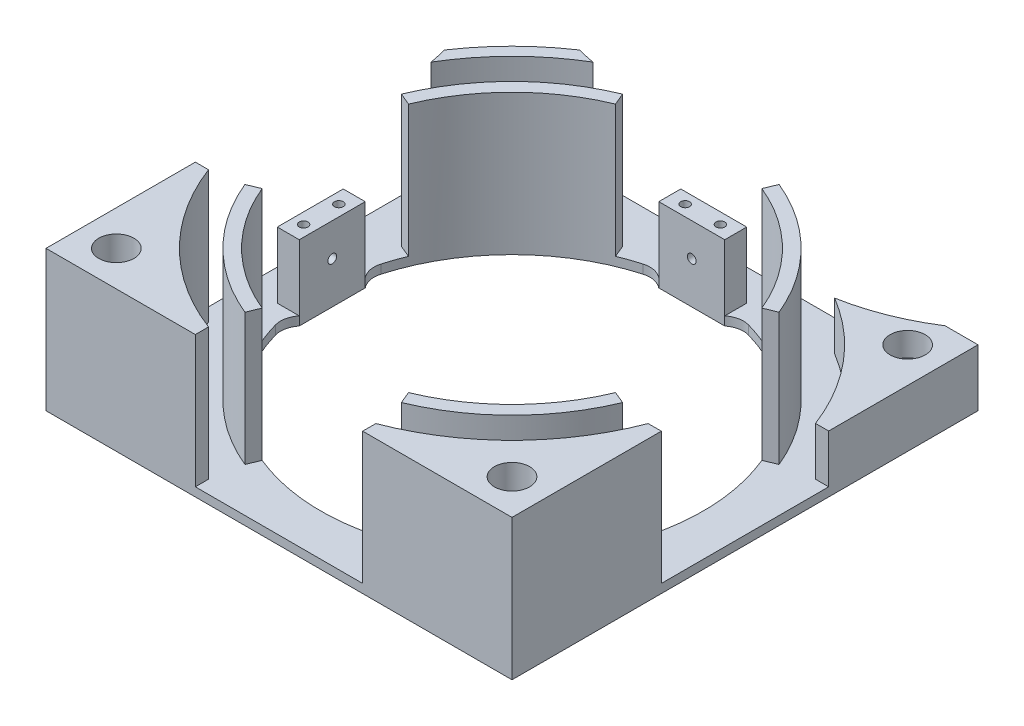
from build123d import *
from build123d.topology import SkipClean

# Parameters (mm, degrees)
SKETCH1_W                                           = 106
SKETCH1_H                                           = 106
BOSS_EXTRUDE1_DEPTH                                 = 2
SKETCH2_R                                           = 46.5
SKETCH2_R_2                                         = 43.5
BOSS_EXTRUDE2_DEPTH                                 = 30
CUT_EXTRUDE1_REACH                                  = 82.734
SKETCH3_R                                           = 43.5
CUT_EXTRUDE2_START                                  = -30
CUT_EXTRUDE2_DEPTH                                  = 30
SKETCH5_W                                           = 15
SKETCH5_H                                           = 5
BOSS_EXTRUDE3_DEPTH                                 = 15
BOSS_EXTRUDE3_DIRECTION_2_REACH                     = 82.734
FILLET1_R                                           = 5
CIRPATTERN1_COUNT                                   = 2
CIRPATTERN1_ANGLE                                   = 90
FILLET1_OF_CIRPATTERN1_R                            = 5
BOSS_EXTRUDE4_DEPTH                                 = 30
BOSS_EXTRUDE5_DEPTH                                 = 15
BOSS_EXTRUDE6_DEPTH                                 = 15
CBORE_FOR_M4_HEX_SOCKET_HEAD_CAP_SCREW1_D           = 4.5
CBORE_FOR_M4_HEX_SOCKET_HEAD_CAP_SCREW1_CBORE_D     = 8
CBORE_FOR_M4_HEX_SOCKET_HEAD_CAP_SCREW1_CBORE_DEPTH = 24.4
CUT_EXTRUDE4_DEPTH                                  = 19
CUT_EXTRUDE5_REACH                                  = 118.672
SKETCH15_R                                          = 1
CUT_EXTRUDE6_REACH                                  = 118.672
SKETCH16_R                                          = 1
SKETCH17_R                                          = 1
CUT_EXTRUDE7_DEPTH                                  = 10


with BuildPart() as part:
    # Sketch1 → Boss-Extrude1 (new body)
    with BuildSketch(Plane(origin=(0, 0, 0), x_dir=(1, 0, 0), z_dir=(0, 1, 0))):
        Rectangle(SKETCH1_W, SKETCH1_H)
    extrude(amount=BOSS_EXTRUDE1_DEPTH)

    # Sketch2 → Boss-Extrude2 (add)
    with BuildSketch(Plane(origin=(0, 2, 0), x_dir=(1, 0, 0), z_dir=(0, 1, 0))):
        with Locations(Location((0, 0, 0), (0, 0, 90))):
            Circle(SKETCH2_R)
        with Locations(Location((0, 0, 0), (0, 0, 270))):
            Circle(SKETCH2_R_2, mode=Mode.SUBTRACT)
    extrude(amount=BOSS_EXTRUDE2_DEPTH)

    # Sketch3 → Cut-Extrude1 (cut, up to next)
    with BuildSketch(Plane(origin=(0, 2, 0), x_dir=(1, 0, 0), z_dir=(0, 1, 0)), mode=Mode.PRIVATE) as cut_extrude1_sk1:
        with Locations(Location((0, 0, 0), (0, 0, 90))):
            Circle(SKETCH3_R)
    cut_extrude1_tool1 = extrude(cut_extrude1_sk1.sketch, amount=-CUT_EXTRUDE1_REACH, mode=Mode.PRIVATE) & part.part
    add(cut_extrude1_tool1.solids().sort_by_distance((0, 2, 0))[0], mode=Mode.SUBTRACT)

    # Sketch4 → Cut-Extrude2 (cut)
    with BuildSketch(Plane(origin=(0, 32, 0), x_dir=(1, 0, 0), z_dir=(0, 1, 0)).offset(CUT_EXTRUDE2_START)):
        with BuildLine():
            ThreePointArc((-40.188759664, -16.646729308), (-43.5, 0), (-40.188759664, 16.646729308))
            Line((-40.188759664, 16.646729308), (-42.960398262, 17.794779605))
            ThreePointArc((-42.960398262, 17.794779605), (-46.5, 0), (-42.960398262, -17.794779605))
            Line((-42.960398262, -17.794779605), (-40.188759664, -16.646729308))
        make_face()
        with BuildLine():
            Line((-17.794779605, 42.960398262), (-16.646729308, 40.188759664))
            ThreePointArc((-16.646729308, 40.188759664), (0, 43.5), (16.646729308, 40.188759664))
            Line((16.646729308, 40.188759664), (17.794779605, 42.960398262))
            ThreePointArc((17.794779605, 42.960398262), (0, 46.5), (-17.794779605, 42.960398262))
        make_face()
        with BuildLine():
            Line((42.960398262, 17.794779605), (40.188759664, 16.646729308))
            ThreePointArc((40.188759664, 16.646729308), (42.664159698, 8.486429008), (43.5, 0))
            ThreePointArc((43.5, 0), (42.664159698, -8.486429008), (40.188759664, -16.646729308))
            Line((40.188759664, -16.646729308), (42.960398262, -17.794779605))
            ThreePointArc((42.960398262, -17.794779605), (45.606515539, -9.071699974), (46.5, 0))
            ThreePointArc((46.5, 0), (45.606515539, 9.071699974), (42.960398262, 17.794779605))
        make_face()
        with BuildLine():
            ThreePointArc((-16.646729308, -40.188759664), (0, -43.5), (16.646729308, -40.188759664))
            Line((16.646729308, -40.188759664), (17.794779605, -42.960398262))
            ThreePointArc((17.794779605, -42.960398262), (0, -46.5), (-17.794779605, -42.960398262))
            Line((-17.794779605, -42.960398262), (-16.646729308, -40.188759664))
        make_face()
    extrude(amount=CUT_EXTRUDE2_DEPTH, mode=Mode.SUBTRACT)

    # Sketch5 → Boss-Extrude3 (add)
    with SkipClean():  # the faces are left unmerged after this step: merging them gives an invalid solid
        with BuildSketch(Plane(origin=(0, 2, 0), x_dir=(1, 0, 0), z_dir=(0, 1, 0))):
            with Locations((0, 43.391175622)):
                Rectangle(SKETCH5_W, SKETCH5_H)
        boss_extrude3 = extrude(amount=BOSS_EXTRUDE3_DEPTH)

    # Boss-Extrude3 direction 2: up to this face of the body (flat: up to its plane)
    boss_extrude3_direction_2_end = Plane(part.part.faces().sort_by_distance((0, 0, 51.500933624))[0])
    # Sketch5 → Boss-Extrude3 direction 2 (add, up to the picked face)
    with BuildSketch(Plane(origin=(0, 2, 0), x_dir=(1, 0, 0), z_dir=(0, 1, 0)), mode=Mode.PRIVATE) as boss_extrude3_direction_2_sk1:
        with Locations((0, 43.391175622)):
            Rectangle(SKETCH5_W, SKETCH5_H)
    boss_extrude3_direction_2_tool1 = split(extrude(boss_extrude3_direction_2_sk1.sketch, amount=-BOSS_EXTRUDE3_DIRECTION_2_REACH, mode=Mode.PRIVATE), bisect_by=boss_extrude3_direction_2_end, keep=Keep.BOTH, mode=Mode.PRIVATE)
    boss_extrude3_direction_2 = boss_extrude3_direction_2_tool1.solids().sort_by(Axis((0, 2, -43.391176), (0, -1, 0)))[0]
    add(boss_extrude3_direction_2)

    # Fillet1
    # the kernel refuses this fillet: 5 mm, written as the material it adds along each edge
    with BuildSketch(Plane(origin=(7.5, 0, -42.848570571), x_dir=(0.9744247966149427, 0, 0.2247138530263045), z_dir=(0, 1, 0))) as fillet1_piece_1:
        with BuildLine():
            CenterArc((4.374240829, -4.992880869), FILLET1_R, 86.942139574, 54.952511428)
            Line((0.439853761, -1.907334175), (0.36116602, -1.845623241))
            ThreePointArc((0.36116602, -1.845623241), (0.122484401, -0.976138473), (-0.09744248, -0.022471385))
            Line((-0.09744248, -0.022471385), (-0.00533444, 0.099857617))
            ThreePointArc((-0.00533444, 0.099857617), (2.320481415, 0.161936438), (4.64629727, 0.099857617))
            Line((4.64629727, 0.099857617), (4.64096283, 0))
        make_face()
    extrude(amount=2)
    with BuildSketch(Plane(origin=(-7.5, 0, -42.848570571), x_dir=(-0.9744247966149427, 0, 0.2247138530263046), z_dir=(0, 1, 0))) as fillet1_piece_2:
        with BuildLine():
            CenterArc((4.374240829, 4.992880869), FILLET1_R, 218.105348998, 54.952511428)
            Line((0.439853761, 1.907334175), (0.36116602, 1.845623241))
            ThreePointArc((0.36116602, 1.845623241), (0.122484401, 0.976138473), (-0.09744248, 0.022471385))
            Line((-0.09744248, 0.022471385), (-0.00533444, -0.099857617))
            ThreePointArc((-0.00533444, -0.099857617), (2.320481415, -0.161936438), (4.64629727, -0.099857617))
            Line((4.64629727, -0.099857617), (4.64096283, 0))
        make_face()
    extrude(amount=2)

    # CirPattern1: Boss-Extrude3, Boss-Extrude3 direction 2 ×2 about axis
    cirpattern1_axis = Axis((0, 0, 0), (0, 1, 0))
    add([boss_extrude3.rotate(cirpattern1_axis, i * CIRPATTERN1_ANGLE / (CIRPATTERN1_COUNT - 1)) for i in range(1, CIRPATTERN1_COUNT)])
    add([boss_extrude3_direction_2.rotate(cirpattern1_axis, i * CIRPATTERN1_ANGLE / (CIRPATTERN1_COUNT - 1)) for i in range(1, CIRPATTERN1_COUNT)])

    # Fillet1 of CirPattern1
    # the kernel refuses this fillet: 5 mm, written as the material it adds along each edge
    with BuildSketch(Plane(origin=(-42.848570571, 0, -7.5), x_dir=(1, 0, 0), z_dir=(0, 1, 0))) as fillet1_of_cirpattern1_piece_1:
        with BuildLine():
            CenterArc((5.848139436, 3.140399232), FILLET1_OF_CIRPATTERN1_R, 163.956087306, 54.952511428)
            Line((1.042888639, 4.522269262), (0.946783623, 4.549906663))
            ThreePointArc((0.946783623, 4.549906663), (0.363649439, 2.297523992), (-0.098502461, 0.017241379))
            Line((-0.098502461, 0.017241379), (0, -0.1))
            ThreePointArc((0, -0.1), (0.978697474, -0.1), (1.879580059, -0.062807985))
            Line((1.879580059, -0.062807985), (1.957394949, 0))
        make_face()
    extrude(amount=2)
    with BuildSketch(Plane(origin=(-42.848570571, 0, 7.5), x_dir=(0.22471385302630772, 0, 0.974424796614942), z_dir=(0, 1, 0))) as fillet1_of_cirpattern1_piece_2:
        with BuildLine():
            CenterArc((4.374240829, 4.992880869), FILLET1_OF_CIRPATTERN1_R, 218.105348998, 54.952511428)
            Line((0.439853761, 1.907334175), (0.36116602, 1.845623241))
            ThreePointArc((0.36116602, 1.845623241), (0.122484401, 0.976138473), (-0.09744248, 0.022471385))
            Line((-0.09744248, 0.022471385), (-0.00533444, -0.099857617))
            ThreePointArc((-0.00533444, -0.099857617), (2.320481415, -0.161936438), (4.64629727, -0.099857617))
            Line((4.64629727, -0.099857617), (4.64096283, 0))
        make_face()
    extrude(amount=2)

    # Sketch6 → Boss-Extrude4 (add)
    with BuildSketch(Plane(origin=(0, 2, 0), x_dir=(1, 0, 0), z_dir=(0, 1, 0))):
        with BuildLine():
            Line((50, -19.032866311), (53, -19.032866311))
            Line((53, -19.032866311), (53, -53))
            Line((53, -53), (19.032866311, -53))
            Line((19.032866311, -53), (19.032866311, -50))
            ThreePointArc((19.032866311, -50), (37.830212793, -37.830212793), (50, -19.032866311))
        make_face()
        with BuildLine():
            Line((-19.032866311, -50), (-19.032866311, -53))
            Line((-19.032866311, -53), (-53, -53))
            Line((-53, -53), (-53, -19.032866311))
            Line((-53, -19.032866311), (-50, -19.032866311))
            ThreePointArc((-50, -19.032866311), (-37.830212793, -37.830212793), (-19.032866311, -50))
        make_face()
    extrude(amount=BOSS_EXTRUDE4_DEPTH)

    # Sketch8 → Boss-Extrude5 (add)
    with BuildSketch(Plane(origin=(0, 2, 0), x_dir=(1, 0, 0), z_dir=(0, 1, 0))):
        with BuildLine():
            Line((-53, 53), (-45.5, 53))
            ThreePointArc((-45.5, 53), (-36.847223427, 48.566395788), (-27.5, 45.891175622))
            ThreePointArc((-27.5, 45.891175622), (-37.830212793, 37.830212793), (-45.891175622, 27.5))
            ThreePointArc((-45.891175622, 27.5), (-48.566395788, 36.847223427), (-53, 45.5))
            Line((-53, 45.5), (-53, 53))
        make_face()
        with BuildLine():
            Line((50, 19.032866311), (53, 19.032866311))
            Line((53, 19.032866311), (53, 53))
            Line((53, 53), (45.5, 53))
            ThreePointArc((45.5, 53), (36.847223427, 48.566395788), (27.5, 45.891175622))
            ThreePointArc((27.5, 45.891175622), (41.011031379, 34.356153819), (50, 19.032866311))
        make_face()
    extrude(amount=BOSS_EXTRUDE5_DEPTH)

    # Sketch9 → Boss-Extrude6 (add)
    with BuildSketch(Plane(origin=(0, 17, 0), x_dir=(1, 0, 0), z_dir=(0, 1, 0))):
        with BuildLine():
            Line((50, 19.032866311), (53, 19.032866311))
            ThreePointArc((53, 19.032866311), (44.40829155, 34.628797866), (31.376796705, 46.762662761))
            ThreePointArc((31.376796705, 46.762662761), (29.447059001, 46.288392434), (27.5, 45.891175622))
            ThreePointArc((27.5, 45.891175622), (41.011031379, 34.356153819), (50, 19.032866311))
        make_face()
        with BuildLine():
            ThreePointArc((-45.891175622, 27.5), (-37.830212793, 37.830212793), (-27.5, 45.891175622))
            ThreePointArc((-27.5, 45.891175622), (-29.447059001, 46.288392434), (-31.376796705, 46.762662761))
            ThreePointArc((-31.376796705, 46.762662761), (-39.819907082, 39.819907082), (-46.762662761, 31.376796705))
            ThreePointArc((-46.762662761, 31.376796705), (-46.288392434, 29.447059001), (-45.891175622, 27.5))
        make_face()
    extrude(amount=BOSS_EXTRUDE6_DEPTH)

    # CBORE for M4 Hex Socket Head Cap Screw1 (through all)
    with Locations(Plane(origin=(0, 32, 0), x_dir=(1, 0, 0), z_dir=(0, 1, 0))):
        with Locations((-45, -45), (45, -45), (45, 45), (-45, 45)):
            CounterBoreHole(CBORE_FOR_M4_HEX_SOCKET_HEAD_CAP_SCREW1_D / 2, CBORE_FOR_M4_HEX_SOCKET_HEAD_CAP_SCREW1_CBORE_D / 2, CBORE_FOR_M4_HEX_SOCKET_HEAD_CAP_SCREW1_CBORE_DEPTH)

    # Sketch14 → Cut-Extrude4 (cut)
    with BuildSketch(Plane(origin=(0, 32, 0), x_dir=(1, 0, 0), z_dir=(0, 1, 0))):
        Polygon((50, 19.032866311), (53, 19.032866311), (53, 53), (45.5, 53), (27.5, 45.891175622), align=None)
    extrude(amount=-CUT_EXTRUDE4_DEPTH, mode=Mode.SUBTRACT)

    # Sketch15 → Cut-Extrude5 (cut, up to next)
    with BuildSketch(Plane(origin=(0, 0, -45.891175622), x_dir=(-1, 0, 0), z_dir=(0, 0, -1)), mode=Mode.PRIVATE) as cut_extrude5_sk1:
        with Locations((0, 9.5)):
            Circle(SKETCH15_R)
    cut_extrude5_tool1 = extrude(cut_extrude5_sk1.sketch, amount=-CUT_EXTRUDE5_REACH, mode=Mode.PRIVATE) & part.part
    add(cut_extrude5_tool1.solids().sort_by_distance((0, 9.5, -45.891176))[0], mode=Mode.SUBTRACT)

    # Sketch16 → Cut-Extrude6 (cut, up to next)
    with BuildSketch(Plane.ZY.offset(45.891175622), mode=Mode.PRIVATE) as cut_extrude6_sk1:
        with Locations((0, 9.5)):
            Circle(SKETCH16_R)
    cut_extrude6_tool1 = extrude(cut_extrude6_sk1.sketch, amount=-CUT_EXTRUDE6_REACH, mode=Mode.PRIVATE) & part.part
    add(cut_extrude6_tool1.solids().sort_by_distance((-45.891176, 9.5, 0))[0], mode=Mode.SUBTRACT)

    # Sketch17 → Cut-Extrude7 (cut)
    with BuildSketch(Plane(origin=(0, 17, 0), x_dir=(1, 0, 0), z_dir=(0, 1, 0))):
        with Locations(Location((4, 43.391175622, 0), (0, 0, 270))):
            Circle(SKETCH17_R)
        with Locations(Location((-4, 43.391175622, 0), (0, 0, 270))):
            Circle(SKETCH17_R)
        with Locations(Location((-43.391175622, 4, 0), (0, 0, 270))):
            Circle(SKETCH17_R)
        with Locations(Location((-43.391175622, -4, 0), (0, 0, 270))):
            Circle(SKETCH17_R)
    extrude(amount=-CUT_EXTRUDE7_DEPTH, mode=Mode.SUBTRACT)


solid = part.part
